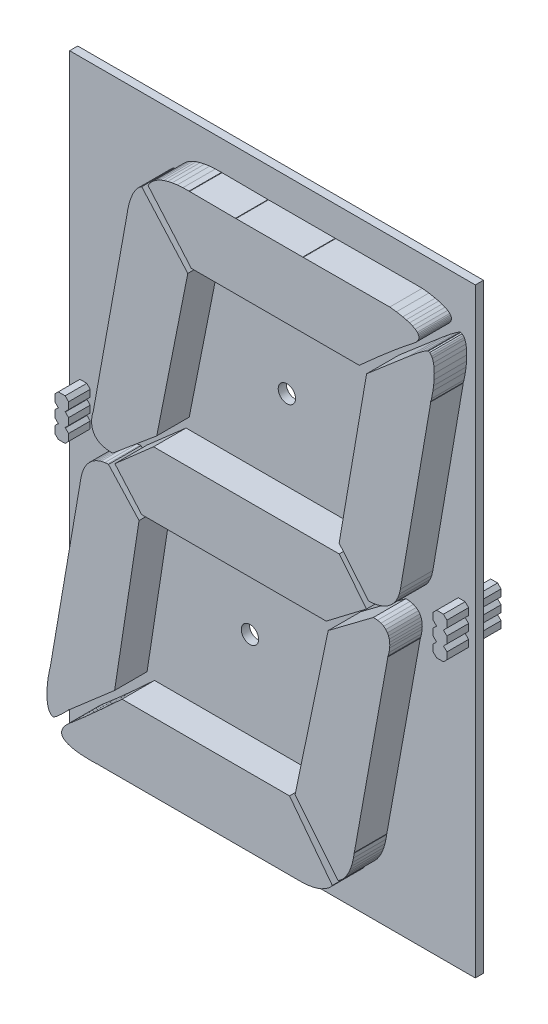
from build123d import *

# Parameters (mm, degrees)
CROQUIS2_W                 = 74.93
CROQUIS2_H                 = 110.871
SALIENTE_EXTRUIR2_DEPTH    = 1.5
SALIENTE_EXTRUIR3_DEPTH    = 6
CORTAR_EXTRUIR1_DEPTH      = 6
CORTAR_EXTRUIR1_DEPTH_BACK = 6
CROQUIS2_5_R               = 1.6
SALIENTE_EXTRUIR4_START    = -6
SALIENTE_EXTRUIR4_DEPTH    = 10


# Read off the part's stored shape, not the designer's step: Saliente-Extruir4
with BuildPart() as part:
    # Croquis2 → Saliente-Extruir2 (new body)
    with BuildSketch(Plane.XY):
        with Locations((37.465, 55.4355)):
            Rectangle(CROQUIS2_W, CROQUIS2_H)
    extrude(amount=-SALIENTE_EXTRUIR2_DEPTH)

    # Croquis2<4> → Saliente-Extruir3 (add)
    with BuildSketch(Plane.XY):
        with BuildLine():
            Line((59.4512, 93.2942), (59.502, 93.2942))
            Line((59.502, 93.2942), (59.539898139, 93.328028554))
            Line((59.539898139, 93.328028554), (62.941023468, 96.363933685))
            ThreePointArc((62.941023468, 96.363933685), (62.945494124, 96.43599486), (63.017509764, 96.430842441))
            Line((63.017509764, 96.430842441), (66.171178839, 99.133262262))
            ThreePointArc((66.171178839, 99.133262262), (66.177093675, 99.205294689), (66.24906445, 99.198671749))
            Line((66.24906445, 99.198671749), (67.832082216, 100.500937582))
            ThreePointArc((67.832082216, 100.500937582), (67.839536944, 100.572832713), (67.9113425, 100.564559567))
            Line((67.9113425, 100.564559567), (69.401112755, 101.731283706))
            Line((69.401112755, 101.731283706), (69.4411, 101.7626))
            Line((69.4411, 101.7626), (69.479097301, 101.796303043))
            Line((69.479097301, 101.796303043), (70.010158781, 102.267346702))
            Line((70.010158781, 102.267346702), (70.0481, 102.301))
            Line((70.0481, 102.301), (70.080499427, 102.340200473))
            Line((70.080499427, 102.340200473), (70.221517438, 102.510819932))
            Line((70.221517438, 102.510819932), (70.2539, 102.55))
            Line((70.2539, 102.55), (70.280410488, 102.593274203))
            Line((70.280410488, 102.593274203), (70.372095705, 102.742935905))
            Line((70.372095705, 102.742935905), (70.3986, 102.7862))
            Line((70.3986, 102.7862), (70.416910347, 102.833565306))
            Line((70.416910347, 102.833565306), (70.466663357, 102.962266669))
            Line((70.466663357, 102.962266669), (70.485, 103.0097))
            Line((70.485, 103.0097), (70.493452398, 103.059749595))
            Line((70.493452398, 103.059749595), (70.512148134, 103.170453557))
            Line((70.512148134, 103.170453557), (70.5206, 103.2205))
            Line((70.5206, 103.2205), (70.516734777, 103.271202631))
            Line((70.516734777, 103.271202631), (70.509160499, 103.370559339))
            Line((70.509160499, 103.370559339), (70.5053, 103.4212))
            Line((70.5053, 103.4212), (70.48964122, 103.469513379))
            Line((70.48964122, 103.469513379), (70.460039131, 103.560847245))
            Line((70.460039131, 103.560847245), (70.4444, 103.6091))
            Line((70.4444, 103.6091), (70.418898932, 103.653099382))
            Line((70.418898932, 103.653099382), (70.368244829, 103.740497652))
            Line((70.368244829, 103.740497652), (70.3428, 103.7844))
            Line((70.3428, 103.7844), (70.309985871, 103.823180334))
            Line((70.309985871, 103.823180334), (70.23588538, 103.910753641))
            Line((70.23588538, 103.910753641), (70.2031, 103.9495))
            Line((70.2031, 103.9495), (70.163251763, 103.981052224))
            Line((70.163251763, 103.981052224), (69.864408307, 104.217679393))
            Line((69.864408307, 104.217679393), (69.8246, 104.2492))
            Line((69.8246, 104.2492), (69.779811808, 104.27312212))
            Line((69.779811808, 104.27312212), (69.3843316, 104.484354695))
            Line((69.3843316, 104.484354695), (69.3395, 104.5083))
            Line((69.3395, 104.5083), (69.292206833, 104.526917367))
            Line((69.292206833, 104.526917367), (68.825372566, 104.710690742))
            Line((68.825372566, 104.710690742), (68.7781, 104.7293))
            Line((68.7781, 104.7293), (68.729494681, 104.744082523))
            Line((68.729494681, 104.744082523), (68.217194025, 104.899890498))
            Line((68.217194025, 104.899890498), (68.1685, 104.9147))
            Line((68.1685, 104.9147), (68.11914709, 104.926738066))
            Line((68.11914709, 104.926738066), (67.593016623, 105.055070785))
            Line((67.593016623, 105.055070785), (67.5437, 105.0671))
            Line((67.5437, 105.0671), (67.493708188, 105.076344104))
            Line((67.493708188, 105.076344104), (66.412549645, 105.276263693))
            Line((66.412549645, 105.276263693), (66.3626, 105.2855))
            Line((66.3626, 105.2855), (66.312148415, 105.291536662))
            Line((66.312148415, 105.291536662), (65.181091139, 105.426870571))
            Line((65.181091139, 105.426870571), (65.1307, 105.4329))
            Line((65.1307, 105.4329), (65.079849986, 105.432754668))
            Line((65.079849986, 105.432754668), (49.15669989, 105.387245475))
            ThreePointArc((49.15669989, 105.387245475), (49.105988252, 105.336299978), (49.055099911, 105.387068971))
            Line((49.055099911, 105.387068971), (36.738750212, 105.379531182))
            ThreePointArc((36.738750212, 105.379531182), (36.68781574, 105.328699956), (36.637150663, 105.3797997))
            Line((36.637150663, 105.3797997), (28.152949348, 105.430002075))
            ThreePointArc((28.152949348, 105.430002075), (28.102277149, 105.379499938), (28.05135278, 105.429747786))
            Line((28.05135278, 105.429747786), (26.974789912, 105.418147287))
            Line((26.974789912, 105.418147287), (26.924, 105.4176))
            Line((26.924, 105.4176), (26.873353042, 105.413809666))
            Line((26.873353042, 105.413809666), (25.923113675, 105.342695327))
            Line((25.923113675, 105.342695327), (25.8724, 105.3389))
            Line((25.8724, 105.3389), (25.822146048, 105.33177786))
            Line((25.822146048, 105.33177786), (24.990521494, 105.21391754))
            Line((24.990521494, 105.21391754), (24.9403, 105.2068))
            Line((24.9403, 105.2068), (24.890655674, 105.195924092))
            Line((24.890655674, 105.195924092), (24.1668694, 105.037359493))
            Line((24.1668694, 105.037359493), (24.1173, 105.0265))
            Line((24.1173, 105.0265), (24.068738769, 105.011686892))
            Line((24.068738769, 105.011686892), (23.449659141, 104.822842974))
            Line((23.449659141, 104.822842974), (23.401, 104.808))
            Line((23.401, 104.808), (23.35384082, 104.789173004))
            Line((23.35384082, 104.789173004), (22.830983371, 104.580436654))
            Line((22.830983371, 104.580436654), (22.7838, 104.5616))
            Line((22.7838, 104.5616), (22.738490874, 104.538617984))
            Line((22.738490874, 104.538617984), (22.303356026, 104.317905805))
            Line((22.303356026, 104.317905805), (22.258, 104.2949))
            Line((22.258, 104.2949), (22.215015566, 104.26797515))
            Line((22.215015566, 104.26797515), (21.859152808, 104.045067679))
            Line((21.859152808, 104.045067679), (21.8161, 104.0181))
            Line((21.8161, 104.0181), (21.775696178, 103.987305014))
            Line((21.775696178, 103.987305014), (21.493267577, 103.772043578))
            Line((21.493267577, 103.772043578), (21.4528, 103.7412))
            Line((21.4528, 103.7412), (21.415487918, 103.706813104))
            Line((21.415487918, 103.706813104), (21.198086197, 103.506455201))
            Line((21.198086197, 103.506455201), (21.1607, 103.472))
            Line((21.1607, 103.472), (21.128237272, 103.432960597))
            Line((21.128237272, 103.432960597), (20.791894482, 103.028477591))
            Line((20.791894482, 103.028477591), (20.7594, 102.9894))
            Line((20.7594, 102.9894), (20.733626132, 102.945664084))
            Line((20.733626132, 102.945664084), (20.584590838, 102.692764712))
            Line((20.584590838, 102.692764712), (20.5588, 102.649))
            Line((20.5588, 102.649), (20.539451758, 102.602078702))
            Line((20.539451758, 102.602078702), (20.524773067, 102.566481502))
            Line((20.524773067, 102.566481502), (20.5054, 102.5195))
            Line((20.5054, 102.5195), (20.538608745, 102.481014417))
            Line((20.538608745, 102.481014417), (28.432612601, 93.332660845))
            Line((28.432612601, 93.332660845), (28.4658, 93.2942))
            Line((28.4658, 93.2942), (28.5166, 93.2942))
            Line((28.5166, 93.2942), (59.4512, 93.2942))
        make_face()
        Polygon((14.391685098, 55.022016938), (14.3535, 54.9885), (14.386950963, 54.950169447), (19.265497916, 49.359974544), (19.2989, 49.3217), (19.3497, 49.3217), (53.345078724, 49.3217), (53.3959, 49.3217), (53.436277547, 49.352413775), (60.8457, 54.9885), (55.812809992, 61.22277289), (55.7809, 61.2623), (55.7301, 61.2623), (21.551870759, 61.2623), (21.5011, 61.2623), (21.462918345, 61.228786084), align=None)
        with BuildLine():
            Line((15.7302, 17.9756), (15.6794, 17.9756))
            Line((15.6794, 17.9756), (15.642014267, 17.941206004))
            Line((15.642014267, 17.941206004), (11.973109053, 14.565899445))
            ThreePointArc((11.973109053, 14.565899445), (11.969875017, 14.493977228), (11.897963922, 14.497449787))
            Line((11.897963922, 14.497449787), (8.920105145, 11.812002677))
            ThreePointArc((8.920105145, 11.812002677), (8.915958328, 11.739898837), (8.843908054, 11.744890634))
            Line((8.843908054, 11.744890634), (6.52320707, 9.748708391))
            ThreePointArc((6.52320707, 9.748708391), (6.517716159, 9.677013821), (6.446034932, 9.682676262))
            Line((6.446034932, 9.682676262), (5.977174803, 9.283617137))
            Line((5.977174803, 9.283617137), (5.9385, 9.2507))
            Line((5.9385, 9.2507), (5.901724969, 9.215576226))
            Line((5.901724969, 9.215576226), (5.523123571, 8.853974625))
            Line((5.523123571, 8.853974625), (5.4864, 8.8189))
            Line((5.4864, 8.8189), (5.452588831, 8.781009964))
            Line((5.452588831, 8.781009964), (5.162056921, 8.455429244))
            Line((5.162056921, 8.455429244), (5.1283, 8.4176))
            Line((5.1283, 8.4176), (5.098110618, 8.376692165))
            Line((5.098110618, 8.376692165), (4.886637227, 8.090137162))
            Line((4.886637227, 8.090137162), (4.8565, 8.0493))
            Line((4.8565, 8.0493), (4.831672954, 8.004937132))
            Line((4.831672954, 8.004937132), (4.690795104, 7.753205793))
            Line((4.690795104, 7.753205793), (4.666, 7.7089))
            Line((4.666, 7.7089), (4.648416302, 7.661225563))
            Line((4.648416302, 7.661225563), (4.569283329, 7.446673436))
            Line((4.569283329, 7.446673436), (4.5517, 7.399))
            Line((4.5517, 7.399), (4.544504099, 7.348699413))
            Line((4.544504099, 7.348699413), (4.518194061, 7.164787727))
            Line((4.518194061, 7.164787727), (4.511, 7.1145))
            Line((4.511, 7.1145), (4.515517367, 7.063901547))
            Line((4.515517367, 7.063901547), (4.529388504, 6.908532694))
            Line((4.529388504, 6.908532694), (4.5339, 6.858))
            Line((4.5339, 6.858), (4.551057108, 6.810152551))
            Line((4.551057108, 6.810152551), (4.600542892, 6.672147449))
            Line((4.600542892, 6.672147449), (4.6177, 6.6243))
            Line((4.6177, 6.6243), (4.645611276, 6.581924499))
            Line((4.645611276, 6.581924499), (4.726930063, 6.458464562))
            Line((4.726930063, 6.458464562), (4.7549, 6.416))
            Line((4.7549, 6.416), (4.791046691, 6.38034665))
            Line((4.791046691, 6.38034665), (4.909232314, 6.263774059))
            Line((4.909232314, 6.263774059), (4.9454, 6.2281))
            Line((4.9454, 6.2281), (4.986891452, 6.198787896))
            Line((4.986891452, 6.198787896), (5.137603741, 6.0923155))
            Line((5.137603741, 6.0923155), (5.1791, 6.063))
            Line((5.1791, 6.063), (5.225020097, 6.041342705))
            Line((5.225020097, 6.041342705), (5.71479468, 5.810350325))
            Line((5.71479468, 5.810350325), (5.7607, 5.7887))
            Line((5.7607, 5.7887), (5.809468268, 5.774512867))
            Line((5.809468268, 5.774512867), (6.410444939, 5.59968329))
            Line((6.410444939, 5.59968329), (6.4592, 5.5855))
            Line((6.4592, 5.5855), (6.509163306, 5.57632254))
            Line((6.509163306, 5.57632254), (7.183933111, 5.452378118))
            Line((7.183933111, 5.452378118), (7.2339, 5.4432))
            Line((7.2339, 5.4432), (7.284345417, 5.437310942))
            Line((7.284345417, 5.437310942), (7.988634854, 5.355091361))
            Line((7.988634854, 5.355091361), (8.0391, 5.3492))
            Line((8.0391, 5.3492), (8.089846012, 5.34686364))
            Line((8.089846012, 5.34686364), (9.532700675, 5.280434211))
            Line((9.532700675, 5.280434211), (9.5834, 5.2781))
            Line((9.5834, 5.2781), (9.634249984, 5.27865149))
            Line((9.634249984, 5.27865149), (10.703553708, 5.29024855))
            Line((10.703553708, 5.29024855), (10.7544, 5.2908))
            Line((10.7544, 5.2908), (10.80510372, 5.29301447))
            Line((10.80510372, 5.29301447), (11.168448381, 5.308883438))
            ThreePointArc((11.168448381, 5.308883438), (11.218091455, 5.361887903), (11.27, 5.3111))
            Line((11.27, 5.3111), (48.435273209, 5.3111))
            Line((48.435273209, 5.3111), (48.4861, 5.3111))
            Line((48.4861, 5.3111), (48.53680053, 5.312783604))
            Line((48.53680053, 5.312783604), (49.278564726, 5.337415242))
            Line((49.278564726, 5.337415242), (49.3293, 5.3391))
            Line((49.3293, 5.3391), (49.379945918, 5.343794205))
            Line((49.379945918, 5.343794205), (50.045891555, 5.405518537))
            Line((50.045891555, 5.405518537), (50.0964, 5.4102))
            Line((50.0964, 5.4102), (50.146547317, 5.41846628))
            Line((50.146547317, 5.41846628), (50.739695851, 5.516240836))
            Line((50.739695851, 5.516240836), (50.7898, 5.5245))
            Line((50.7898, 5.5245), (50.839354522, 5.536030604))
            Line((50.839354522, 5.536030604), (51.36268731, 5.657802398))
            Line((51.36268731, 5.657802398), (51.4121, 5.6693))
            Line((51.4121, 5.6693), (51.460643753, 5.684370117))
            Line((51.460643753, 5.684370117), (51.919913347, 5.826947609))
            Line((51.919913347, 5.826947609), (51.9684, 5.842))
            Line((51.9684, 5.842), (52.015588208, 5.860729735))
            Line((52.015588208, 5.860729735), (52.413891311, 6.018822444))
            Line((52.413891311, 6.018822444), (52.4612, 6.0376))
            Line((52.4612, 6.0376), (52.506200819, 6.061098434))
            Line((52.506200819, 6.061098434), (53.21875904, 6.433180605))
            Line((53.21875904, 6.433180605), (53.2638, 6.4567))
            Line((53.2638, 6.4567), (53.305086619, 6.486318661))
            Line((53.305086619, 6.486318661), (53.806683936, 6.846160215))
            Line((53.806683936, 6.846160215), (53.848, 6.8758))
            Line((53.848, 6.8758), (53.884747126, 6.910853009))
            Line((53.884747126, 6.910853009), (54.197360673, 7.209054431))
            Line((54.197360673, 7.209054431), (54.2341, 7.2441))
            Line((54.2341, 7.2441), (54.265505983, 7.283995291))
            Line((54.265505983, 7.283995291), (54.484576784, 7.562282817))
            Line((54.484576784, 7.562282817), (54.516, 7.6022))
            Line((54.516, 7.6022), (54.485222264, 7.642616964))
            Line((54.485222264, 7.642616964), (46.647376782, 17.935184289))
            Line((46.647376782, 17.935184289), (46.6166, 17.9756))
            Line((46.6166, 17.9756), (46.5658, 17.9756))
            Line((46.5658, 17.9756), (15.7302, 17.9756))
        make_face()
        with BuildLine():
            Line((72.292544417, 101.909138837), (72.2452, 101.9277))
            Line((72.2452, 101.9277), (72.194795614, 101.921837951))
            Line((72.194795614, 101.921837951), (72.186447995, 101.92086712))
            Line((72.186447995, 101.92086712), (72.136, 101.915))
            Line((72.136, 101.915), (72.089340365, 101.894877856))
            Line((72.089340365, 101.894877856), (72.017561623, 101.863923002))
            Line((72.017561623, 101.863923002), (71.9709, 101.8438))
            Line((71.9709, 101.8438), (71.927578968, 101.817326036))
            Line((71.927578968, 101.817326036), (71.55707594, 101.590907519))
            Line((71.55707594, 101.590907519), (71.5137, 101.5644))
            Line((71.5137, 101.5644), (71.472931064, 101.534128945))
            Line((71.472931064, 101.534128945), (70.360702815, 100.70829621))
            Line((70.360702815, 100.70829621), (70.3199, 100.678))
            Line((70.3199, 100.678), (70.280619956, 100.645753944))
            Line((70.280619956, 100.645753944), (68.756409642, 99.394488261))
            Line((68.756409642, 99.394488261), (68.7172, 99.3623))
            Line((68.7172, 99.3623), (68.678593072, 99.329174506))
            Line((68.678593072, 99.329174506), (60.88429034, 92.641511262))
            Line((60.88429034, 92.641511262), (60.8457, 92.6084))
            Line((60.8457, 92.6084), (60.837128661, 92.558279125))
            Line((60.837128661, 92.558279125), (55.789461797, 63.042065076))
            Line((55.789461797, 63.042065076), (55.7809, 62.992))
            Line((55.7809, 62.992), (55.81332664, 62.952875638))
            Line((55.81332664, 62.952875638), (61.171396178, 56.488096832))
            Line((61.171396178, 56.488096832), (61.2038, 56.449))
            Line((61.2038, 56.449), (61.2547, 56.449))
            Line((61.2547, 56.449), (61.3715, 56.449))
            Line((61.3715, 56.449), (61.4223, 56.449))
            Line((61.4223, 56.449), (61.472976674, 56.452537608))
            Line((61.472976674, 56.452537608), (61.953249009, 56.486064185))
            Line((61.953249009, 56.486064185), (62.0039, 56.4896))
            Line((62.0039, 56.4896), (62.053978839, 56.498555879))
            Line((62.053978839, 56.498555879), (62.792089943, 56.630556422))
            Line((62.792089943, 56.630556422), (62.8421, 56.6395))
            Line((62.8421, 56.6395), (62.891108177, 56.653168671))
            Line((62.891108177, 56.653168671), (63.275784121, 56.760457071))
            Line((63.275784121, 56.760457071), (63.3247, 56.7741))
            Line((63.3247, 56.7741), (63.372360838, 56.791816066))
            Line((63.372360838, 56.791816066), (63.78257028, 56.944295501))
            Line((63.78257028, 56.944295501), (63.8302, 56.962))
            Line((63.8302, 56.962), (63.876168828, 56.983745146))
            Line((63.876168828, 56.983745146), (64.299904864, 57.184189714))
            Line((64.299904864, 57.184189714), (64.3458, 57.2059))
            Line((64.3458, 57.2059), (64.389108175, 57.232397207))
            Line((64.389108175, 57.232397207), (64.813037875, 57.491769785))
            Line((64.813037875, 57.491769785), (64.8564, 57.5183))
            Line((64.8564, 57.5183), (64.896249371, 57.549729806))
            Line((64.896249371, 57.549729806), (65.309240428, 57.875462148))
            Line((65.309240428, 57.875462148), (65.3491, 57.9069))
            Line((65.3491, 57.9069), (65.38475257, 57.9431432))
            Line((65.38475257, 57.9431432), (65.778244921, 58.34315425))
            Line((65.778244921, 58.34315425), (65.8139, 58.3794))
            Line((65.8139, 58.3794), (65.844225502, 58.420195795))
            Line((65.844225502, 58.420195795), (66.202723305, 58.902469863))
            Line((66.202723305, 58.902469863), (66.233, 58.9432))
            Line((66.233, 58.9432), (66.257279162, 58.987827348))
            Line((66.257279162, 58.987827348), (66.569427555, 59.561584998))
            Line((66.569427555, 59.561584998), (66.5937, 59.6062))
            Line((66.5937, 59.6062), (66.61158779, 59.65373606))
            Line((66.61158779, 59.65373606), (66.865399906, 60.328231243))
            Line((66.865399906, 60.328231243), (66.8833, 60.3758))
            Line((66.8833, 60.3758), (66.894781535, 60.425281675))
            Line((66.894781535, 60.425281675), (67.07750503, 61.212760424))
            Line((67.07750503, 61.212760424), (67.089, 61.2623))
            Line((67.089, 61.2623), (67.097573527, 61.31232841))
            Line((67.097573527, 61.31232841), (72.7091207, 94.056937903))
            ThreePointArc((72.7091207, 94.056937903), (72.667907393, 94.117229151), (72.729567136, 94.156365417))
            Line((72.729567136, 94.156365417), (72.832823208, 94.585894415))
            Line((72.832823208, 94.585894415), (72.8447, 94.6353))
            Line((72.8447, 94.6353), (72.854287899, 94.685200323))
            Line((72.854287899, 94.685200323), (73.096704243, 95.946858779))
            Line((73.096704243, 95.946858779), (73.1063, 95.9968))
            Line((73.1063, 95.9968), (73.113314551, 96.047069068))
            Line((73.113314551, 96.047069068), (73.223675607, 96.837960399))
            Line((73.223675607, 96.837960399), (73.2307, 96.8883))
            Line((73.2307, 96.8883), (73.235174296, 96.938941368))
            Line((73.235174296, 96.938941368), (73.312629131, 97.815597418))
            Line((73.312629131, 97.815597418), (73.3171, 97.8662))
            Line((73.3171, 97.8662), (73.318740893, 97.916973196))
            Line((73.318740893, 97.916973196), (73.348456618, 98.836449785))
            Line((73.348456618, 98.836449785), (73.3501, 98.8873))
            Line((73.3501, 98.8873), (73.347583105, 98.938014434))
            Line((73.347583105, 98.938014434), (73.301818736, 99.86014847))
            Line((73.301818736, 99.86014847), (73.2993, 99.9109))
            Line((73.2993, 99.9109), (73.291696285, 99.961131794))
            Line((73.291696285, 99.961131794), (73.210398927, 100.498199837))
            Line((73.210398927, 100.498199837), (73.2028, 100.5484))
            Line((73.2028, 100.5484), (73.187704965, 100.596876179))
            Line((73.187704965, 100.596876179), (73.024902236, 101.119700696))
            Line((73.024902236, 101.119700696), (73.0098, 101.1682))
            Line((73.0098, 101.1682), (72.986579324, 101.213378094))
            Line((72.986579324, 101.213378094), (72.893294476, 101.394872881))
            Line((72.893294476, 101.394872881), (72.8701, 101.44))
            Line((72.8701, 101.44), (72.839032376, 101.480182951))
            Line((72.839032376, 101.480182951), (72.728387988, 101.62329071))
            Line((72.728387988, 101.62329071), (72.6973, 101.6635))
            Line((72.6973, 101.6635), (72.657897458, 101.695604356))
            Line((72.657897458, 101.695604356), (72.530944341, 101.799043065))
            Line((72.530944341, 101.799043065), (72.4916, 101.8311))
            Line((72.4916, 101.8311), (72.444304366, 101.849642038))
            Line((72.444304366, 101.849642038), (72.292544417, 101.909138837))
        make_face()
        with BuildLine():
            Line((16.7201923, 96.726401267), (16.589384826, 95.927969499))
            ThreePointArc((16.589384826, 95.927969499), (16.63129794, 95.869188009), (16.572161469, 95.827777256))
            Line((16.572161469, 95.827777256), (10.377314731, 61.436745771))
            ThreePointArc((10.377314731, 61.436745771), (10.417523735, 61.374185511), (10.35225, 61.33855))
            Line((10.35225, 61.33855), (10.313236413, 61.221509239))
            Line((10.313236413, 61.221509239), (10.2972, 61.1734))
            Line((10.2972, 61.1734), (10.284870588, 61.124082353))
            Line((10.284870588, 61.124082353), (10.169796751, 60.663787006))
            Line((10.169796751, 60.663787006), (10.1575, 60.6146))
            Line((10.1575, 60.6146), (10.151017883, 60.564197712))
            Line((10.151017883, 60.564197712), (10.06238001, 59.874985905))
            Line((10.06238001, 59.874985905), (10.0559, 59.8246))
            Line((10.0559, 59.8246), (10.055604519, 59.773799974))
            Line((10.055604519, 59.773799974), (10.053595344, 59.428376498))
            Line((10.053595344, 59.428376498), (10.0533, 59.3776))
            Line((10.0533, 59.3776), (10.058604754, 59.327100499))
            Line((10.058604754, 59.327100499), (10.096285092, 58.96839616))
            Line((10.096285092, 58.96839616), (10.1016, 58.9178))
            Line((10.1016, 58.9178), (10.113527729, 58.868444618))
            Line((10.113527729, 58.868444618), (10.201392465, 58.504871824))
            Line((10.201392465, 58.504871824), (10.2133, 58.4556))
            Line((10.2133, 58.4556), (10.233094846, 58.408797823))
            Line((10.233094846, 58.408797823), (10.381507261, 58.057897195))
            Line((10.381507261, 58.057897195), (10.4013, 58.0111))
            Line((10.4013, 58.0111), (10.42960149, 57.968900999))
            Line((10.42960149, 57.968900999), (10.652417097, 57.636671286))
            Line((10.652417097, 57.636671286), (10.6807, 57.5945))
            Line((10.6807, 57.5945), (10.717200298, 57.559200308))
            Line((10.717200298, 57.559200308), (11.030269258, 57.256429135))
            Line((11.030269258, 57.256429135), (11.0668, 57.2211))
            Line((11.0668, 57.2211), (11.109720204, 57.194002834))
            Line((11.109720204, 57.194002834), (11.526766474, 56.930705577))
            Line((11.526766474, 56.930705577), (11.5697, 56.9036))
            Line((11.5697, 56.9036), (11.617100464, 56.885401208))
            Line((11.617100464, 56.885401208), (12.157299077, 56.677998969))
            Line((12.157299077, 56.677998969), (12.2047, 56.6598))
            Line((12.2047, 56.6598), (12.254493909, 56.649869408))
            Line((12.254493909, 56.649869408), (12.932137355, 56.514724357))
            Line((12.932137355, 56.514724357), (12.9819, 56.5048))
            Line((12.9819, 56.5048), (13.03265219, 56.501786622))
            Line((13.03265219, 56.501786622), (13.871017701, 56.452009228))
            Line((13.871017701, 56.452009228), (13.9217, 56.449))
            Line((13.9217, 56.449), (13.960648003, 56.48166193))
            Line((13.960648003, 56.48166193), (22.051494972, 63.266674109))
            Line((22.051494972, 63.266674109), (22.0904, 63.2993))
            Line((22.0904, 63.2993), (22.100296105, 63.349100774))
            Line((22.100296105, 63.349100774), (27.815797653, 92.111567814))
            Line((27.815797653, 92.111567814), (27.8257, 92.1614))
            Line((27.8257, 92.1614), (27.792059562, 92.199358465))
            Line((27.792059562, 92.199358465), (19.3504083, 101.724564963))
            Line((19.3504083, 101.724564963), (19.3167, 101.7626))
            Line((19.3167, 101.7626), (19.273724808, 101.735489968))
            Line((19.273724808, 101.735489968), (19.029490071, 101.581419418))
            Line((19.029490071, 101.581419418), (18.9865, 101.5543))
            Line((18.9865, 101.5543), (18.949026027, 101.520076266))
            Line((18.949026027, 101.520076266), (18.673507152, 101.268454035))
            Line((18.673507152, 101.268454035), (18.636, 101.2342))
            Line((18.636, 101.2342), (18.603773913, 101.195030339))
            Line((18.603773913, 101.195030339), (18.244041533, 100.757788436))
            Line((18.244041533, 100.757788436), (18.2118, 100.7186))
            Line((18.2118, 100.7186), (18.185498294, 100.675201034))
            Line((18.185498294, 100.675201034), (17.780944567, 100.007669688))
            Line((17.780944567, 100.007669688), (17.7546, 99.9642))
            Line((17.7546, 99.9642), (17.734285332, 99.917606393))
            Line((17.734285332, 99.917606393), (17.32530995, 98.979582786))
            Line((17.32530995, 98.979582786), (17.305, 98.933))
            Line((17.305, 98.933), (17.288932284, 98.884789228))
            Line((17.288932284, 98.884789228), (17.110284645, 98.348761567))
            Line((17.110284645, 98.348761567), (17.0942, 98.3005))
            Line((17.0942, 98.3005), (17.080995887, 98.251501111))
            Line((17.080995887, 98.251501111), (16.914396634, 97.633271135))
            Line((16.914396634, 97.633271135), (16.9012, 97.5843))
            Line((16.9012, 97.5843), (16.890565463, 97.534586003))
            Line((16.890565463, 97.534586003), (16.739043884, 96.826257692))
            Line((16.739043884, 96.826257692), (16.7284, 96.7765))
            Line((16.7284, 96.7765), (16.7201923, 96.726401267))
        make_face()
        with BuildLine():
            Line((2.86357701, 8.807091627), (2.9108, 8.7884))
            Line((2.9108, 8.7884), (2.961150755, 8.795744832))
            Line((2.961150755, 8.795744832), (2.964705374, 8.796263356))
            Line((2.964705374, 8.796263356), (3.015, 8.8036))
            Line((3.015, 8.8036), (3.060702358, 8.825691024))
            Line((3.060702358, 8.825691024), (3.116535932, 8.852679147))
            Line((3.116535932, 8.852679147), (3.1623, 8.8748))
            Line((3.1623, 8.8748), (3.203752138, 8.904130142))
            Line((3.203752138, 8.904130142), (3.512030217, 9.122257372))
            Line((3.512030217, 9.122257372), (3.5535, 9.1516))
            Line((3.5535, 9.1516), (3.591428286, 9.185372022))
            Line((3.591428286, 9.185372022), (4.511173626, 10.00432968))
            Line((4.511173626, 10.00432968), (4.5491, 10.0381))
            Line((4.5491, 10.0381), (4.584943023, 10.074079495))
            Line((4.584943023, 10.074079495), (5.826468257, 11.320331828))
            ThreePointArc((5.826468257, 11.320331828), (5.827626913, 11.393484883), (5.900687564, 11.389630887))
            Line((5.900687564, 11.389630887), (14.269473907, 18.656022487))
            Line((14.269473907, 18.656022487), (14.3078, 18.6893))
            Line((14.3078, 18.6893), (14.315510249, 18.739551241))
            Line((14.315510249, 18.739551241), (18.816191326, 48.072559026))
            Line((18.816191326, 48.072559026), (18.8239, 48.1228))
            Line((18.8239, 48.1228), (18.789571731, 48.160249795))
            Line((18.789571731, 48.160249795), (13.214392628, 54.242389087))
            Line((13.214392628, 54.242389087), (13.1801, 54.2798))
            Line((13.1801, 54.2798), (13.129266218, 54.2798))
            Line((13.129266218, 54.2798), (13.048, 54.2798))
            Line((13.048, 54.2798), (12.9972, 54.2798))
            Line((12.9972, 54.2798), (12.94659213, 54.275385988))
            Line((12.94659213, 54.275385988), (12.552498848, 54.241013225))
            Line((12.552498848, 54.241013225), (12.5019, 54.2366))
            Line((12.5019, 54.2366), (12.452184585, 54.226203003))
            Line((12.452184585, 54.226203003), (11.835339111, 54.097201953))
            Line((11.835339111, 54.097201953), (11.7856, 54.0868))
            Line((11.7856, 54.0868), (11.73736897, 54.070719083))
            Line((11.73736897, 54.070719083), (11.422338827, 53.965683516))
            Line((11.422338827, 53.965683516), (11.3741, 53.9496))
            Line((11.3741, 53.9496), (11.327563345, 53.929338557))
            Line((11.327563345, 53.929338557), (10.988880275, 53.781880435))
            Line((10.988880275, 53.781880435), (10.9423, 53.7616))
            Line((10.9423, 53.7616), (10.897900888, 53.736998197))
            Line((10.897900888, 53.736998197), (10.542216074, 53.539911201))
            Line((10.542216074, 53.539911201), (10.4978, 53.5153))
            Line((10.4978, 53.5153), (10.456407692, 53.485794282))
            Line((10.456407692, 53.485794282), (10.097237932, 53.229766958))
            Line((10.097237932, 53.229766958), (10.0559, 53.2003))
            Line((10.0559, 53.2003), (10.01830548, 53.166070313))
            Line((10.01830548, 53.166070313), (9.6666305, 52.845871397))
            Line((9.6666305, 52.845871397), (9.6291, 52.8117))
            Line((9.6291, 52.8117), (9.595955753, 52.77316492))
            Line((9.595955753, 52.77316492), (9.255900049, 52.377799958))
            Line((9.255900049, 52.377799958), (9.2227, 52.3392))
            Line((9.2227, 52.3392), (9.194931875, 52.296692075))
            Line((9.194931875, 52.296692075), (8.882174012, 51.817916937))
            Line((8.882174012, 51.817916937), (8.8544, 51.7754))
            Line((8.8544, 51.7754), (8.832024738, 51.729768506))
            Line((8.832024738, 51.729768506), (8.551667613, 51.158015895))
            Line((8.551667613, 51.158015895), (8.5293, 51.1124))
            Line((8.5293, 51.1124), (8.512857337, 51.064329647))
            Line((8.512857337, 51.064329647), (8.281616648, 50.388294297))
            Line((8.281616648, 50.388294297), (8.2652, 50.3403))
            Line((8.2652, 50.3403), (8.254105621, 50.290677561))
            Line((8.254105621, 50.290677561), (8.078081599, 49.503365273))
            Line((8.078081599, 49.503365273), (8.067, 49.4538))
            Line((8.067, 49.4538), (8.058428316, 49.403759226))
            Line((8.058428316, 49.403759226), (2.449465702, 16.659105847))
            ThreePointArc((2.449465702, 16.659105847), (2.490684624, 16.598823944), (2.429025602, 16.559695023))
            Line((2.429025602, 16.559695023), (2.325774663, 16.130106077))
            Line((2.325774663, 16.130106077), (2.3139, 16.0807))
            Line((2.3139, 16.0807), (2.304333851, 16.030916531))
            Line((2.304333851, 16.030916531), (2.061888949, 14.769202125))
            Line((2.061888949, 14.769202125), (2.0523, 14.7193))
            Line((2.0523, 14.7193), (2.045277303, 14.668972555))
            Line((2.045277303, 14.668972555), (1.934912619, 13.878055225))
            Line((1.934912619, 13.878055225), (1.9279, 13.8278))
            Line((1.9279, 13.8278), (1.923285331, 13.777168409))
            Line((1.923285331, 13.777168409), (1.843611693, 12.902998936))
            Line((1.843611693, 12.902998936), (1.839, 12.8524))
            Line((1.839, 12.8524), (1.837483035, 12.80161399))
            Line((1.837483035, 12.80161399), (1.810017368, 11.882099484))
            Line((1.810017368, 11.882099484), (1.8085, 11.8313))
            Line((1.8085, 11.8313), (1.810884689, 11.780533837))
            Line((1.810884689, 11.780533837), (1.854318599, 10.855896165))
            Line((1.854318599, 10.855896165), (1.8567, 10.8052))
            Line((1.8567, 10.8052), (1.864511433, 10.754941981))
            Line((1.864511433, 10.754941981), (1.947997642, 10.217799634))
            Line((1.947997642, 10.217799634), (1.9558, 10.1676))
            Line((1.9558, 10.1676), (1.970906272, 10.119095562))
            Line((1.970906272, 10.119095562), (2.133705312, 9.596367243))
            Line((2.133705312, 9.596367243), (2.1488, 9.5479))
            Line((2.1488, 9.5479), (2.172217988, 9.502757092))
            Line((2.172217988, 9.502757092), (2.26513441, 9.323641899))
            Line((2.26513441, 9.323641899), (2.2885, 9.2786))
            Line((2.2885, 9.2786), (2.319057277, 9.238024533))
            Line((2.319057277, 9.238024533), (2.428157598, 9.093155716))
            Line((2.428157598, 9.093155716), (2.4587, 9.0526))
            Line((2.4587, 9.0526), (2.49830197, 9.020716897))
            Line((2.49830197, 9.020716897), (2.627445735, 8.916744696))
            Line((2.627445735, 8.916744696), (2.667, 8.8849))
            Line((2.667, 8.8849), (2.71429545, 8.866179693))
            Line((2.71429545, 8.866179693), (2.86357701, 8.807091627))
        make_face()
        with BuildLine():
            Line((58.43345449, 13.989649251), (58.566495382, 14.788249847))
            ThreePointArc((58.566495382, 14.788249847), (58.524804044, 14.847023365), (58.583841761, 14.888339731))
            Line((58.583841761, 14.888339731), (64.778803284, 49.279355188))
            ThreePointArc((64.778803284, 49.279355188), (64.738473644, 49.341653077), (64.803353247, 49.377682843))
            Line((64.803353247, 49.377682843), (64.840844999, 49.494311701))
            Line((64.840844999, 49.494311701), (64.8564, 49.5427))
            Line((64.8564, 49.5427), (64.868504591, 49.592036583))
            Line((64.868504591, 49.592036583), (64.981400123, 50.05218263))
            Line((64.981400123, 50.05218263), (64.9935, 50.1015))
            Line((64.9935, 50.1015), (65.000936953, 50.15175192))
            Line((65.000936953, 50.15175192), (65.102959445, 50.841123741))
            Line((65.102959445, 50.841123741), (65.1104, 50.8914))
            Line((65.1104, 50.8914), (65.112987912, 50.942148044))
            Line((65.112987912, 50.942148044), (65.130610396, 51.287718772))
            Line((65.130610396, 51.287718772), (65.1332, 51.3385))
            Line((65.1332, 51.3385), (65.130961203, 51.389198265))
            Line((65.130961203, 51.389198265), (65.115140536, 51.747462341))
            Line((65.115140536, 51.747462341), (65.1129, 51.7982))
            Line((65.1129, 51.7982), (65.105179904, 51.848396913))
            Line((65.105179904, 51.848396913), (65.049518181, 52.210315543))
            Line((65.049518181, 52.210315543), (65.0418, 52.2605))
            Line((65.0418, 52.2605), (65.027084729, 52.309095378))
            Line((65.027084729, 52.309095378), (64.921923716, 52.656376732))
            Line((64.921923716, 52.656376732), (64.9072, 52.705))
            Line((64.9072, 52.705), (64.884588538, 52.750494305))
            Line((64.884588538, 52.750494305), (64.721491088, 53.078646687))
            Line((64.721491088, 53.078646687), (64.6989, 53.1241))
            Line((64.6989, 53.1241), (64.667257234, 53.16385575))
            Line((64.667257234, 53.16385575), (64.433347741, 53.457738))
            Line((64.433347741, 53.457738), (64.4017, 53.4975))
            Line((64.4017, 53.4975), (64.361971115, 53.529076542))
            Line((64.361971115, 53.529076542), (64.045203206, 53.780843868))
            Line((64.045203206, 53.780843868), (64.0055, 53.8124))
            Line((64.0055, 53.8124), (63.959699281, 53.834498507))
            Line((63.959699281, 53.834498507), (63.545760658, 54.034220822))
            Line((63.545760658, 54.034220822), (63.5, 54.0563))
            Line((63.5, 54.0563), (63.45076542, 54.068711086))
            Line((63.45076542, 54.068711086), (62.924412808, 54.201394403))
            Line((62.924412808, 54.201394403), (62.8752, 54.2138))
            Line((62.8752, 54.2138), (62.824500935, 54.217512609))
            Line((62.824500935, 54.217512609), (62.163880622, 54.265888742))
            Line((62.163880622, 54.265888742), (62.1132, 54.2696))
            Line((62.1132, 54.2696), (62.072581157, 54.239108518))
            Line((62.072581157, 54.239108518), (53.799708049, 48.028883379))
            Line((53.799708049, 48.028883379), (53.7591, 47.9984))
            Line((53.7591, 47.9984), (53.748726402, 47.948694483))
            Line((53.748726402, 47.948694483), (47.653169235, 18.74158461))
            Line((47.653169235, 18.74158461), (47.6428, 18.6919))
            Line((47.6428, 18.6919), (47.674774009, 18.652369432))
            Line((47.674774009, 18.652369432), (55.510242807, 8.965109778))
            Line((55.510242807, 8.965109778), (55.5422, 8.9256))
            Line((55.5422, 8.9256), (55.58849031, 8.946421527))
            Line((55.58849031, 8.946421527), (55.597472052, 8.950461543))
            Line((55.597472052, 8.950461543), (55.6438, 8.9713))
            Line((55.6438, 8.9713), (55.687216627, 8.997672646))
            Line((55.687216627, 8.997672646), (55.872142375, 9.110002451))
            Line((55.872142375, 9.110002451), (55.9156, 9.1364))
            Line((55.9156, 9.1364), (55.955045543, 9.16835551))
            Line((55.955045543, 9.16835551), (56.277409838, 9.429508343))
            Line((56.277409838, 9.429508343), (56.3169, 9.4615))
            Line((56.3169, 9.4615), (56.351200489, 9.498903695))
            Line((56.351200489, 9.498903695), (56.760076812, 9.944771552))
            Line((56.760076812, 9.944771552), (56.7944, 9.9822))
            Line((56.7944, 9.9822), (56.822828674, 10.024280643))
            Line((56.822828674, 10.024280643), (57.279027753, 10.699554859))
            Line((57.279027753, 10.699554859), (57.3075, 10.7417))
            Line((57.3075, 10.7417), (57.331124727, 10.786586981))
            Line((57.331124727, 10.786586981), (57.537820336, 11.179308638))
            Line((57.537820336, 11.179308638), (57.5615, 11.2243))
            Line((57.5615, 11.2243), (57.581952035, 11.270749105))
            Line((57.581952035, 11.270749105), (57.784828621, 11.731506962))
            Line((57.784828621, 11.731506962), (57.8053, 11.778))
            Line((57.8053, 11.778), (57.822507082, 11.825797451))
            Line((57.822507082, 11.825797451), (58.016673709, 12.365149191))
            Line((58.016673709, 12.365149191), (58.0339, 12.413))
            Line((58.0339, 12.413), (58.048028958, 12.461756096))
            Line((58.048028958, 12.461756096), (58.228074043, 13.083054258))
            Line((58.228074043, 13.083054258), (58.2422, 13.1318))
            Line((58.2422, 13.1318), (58.253408609, 13.181298051))
            Line((58.253408609, 13.181298051), (58.413893369, 13.890010683))
            Line((58.413893369, 13.890010683), (58.4251, 13.9395))
            Line((58.4251, 13.9395), (58.43345449, 13.989649251))
        make_face()
    extrude(amount=SALIENTE_EXTRUIR3_DEPTH)

    # Croquis2<5> → Cortar-Extruir1 (cut, two sides: drawn at the far end of the back side and taken through both)
    with BuildSketch(Plane.XY.offset(-CORTAR_EXTRUIR1_DEPTH_BACK)):
        with Locations((40.1269, 76.0705)):
            Circle(CROQUIS2_5_R)
        with Locations((33.3045, 34.1427)):
            Circle(CROQUIS2_5_R)
    extrude(amount=CORTAR_EXTRUIR1_DEPTH + CORTAR_EXTRUIR1_DEPTH_BACK, mode=Mode.SUBTRACT)

    # Saliente-Extruir4 outline → Saliente-Extruir4 (add)
    with BuildSketch(Plane.XY.offset(SALIENTE_EXTRUIR4_START)):
        with BuildLine():
            Line((1.2625, 56.0755), (1.2625, 54.8055))
            Line((1.2625, 54.8055), (1.8616, 54.2064))
            ThreePointArc((1.8616, 54.2064), (1.948355635, 54.1705), (1.8616, 54.1346))
            Line((1.8616, 54.1346), (1.2625, 53.5355))
            Line((1.2625, 53.5355), (1.2625, 52.2655))
            Line((1.2625, 52.2655), (1.8975, 51.6305))
            Line((1.8975, 51.6305), (3.1675, 51.6305))
            Line((3.1675, 51.6305), (3.8025, 52.2655))
            Line((3.8025, 52.2655), (3.8025, 53.5355))
            Line((3.8025, 53.5355), (3.20345, 54.13455))
            ThreePointArc((3.20345, 54.13455), (3.116744365, 54.1705), (3.20345, 54.20645))
            Line((3.20345, 54.20645), (3.8025, 54.8055))
            Line((3.8025, 54.8055), (3.8025, 56.0755))
            Line((3.8025, 56.0755), (3.20345, 56.67455))
            ThreePointArc((3.20345, 56.67455), (3.116744365, 56.7105), (3.20345, 56.74645))
            Line((3.20345, 56.74645), (3.8025, 57.3455))
            Line((3.8025, 57.3455), (3.8025, 58.6155))
            Line((3.8025, 58.6155), (3.1675, 59.2505))
            Line((3.1675, 59.2505), (1.8975, 59.2505))
            Line((1.8975, 59.2505), (1.2625, 58.6155))
            Line((1.2625, 58.6155), (1.2625, 57.3455))
            Line((1.2625, 57.3455), (1.8616, 56.7464))
            ThreePointArc((1.8616, 56.7464), (1.948355635, 56.7105), (1.8616, 56.6746))
            Line((1.8616, 56.6746), (1.2625, 56.0755))
        make_face()
        Polygon((71.1464, 53.5431), (71.1464, 52.2731), (71.7814, 51.6381), (73.0514, 51.6381), (73.6864, 52.2731), (73.6864, 53.5431), (73.0514, 54.1781), (73.6864, 54.8131), (73.6864, 56.0831), (73.0514, 56.7181), (73.6864, 57.3531), (73.6864, 58.6231), (73.0514, 59.2581), (71.7814, 59.2581), (71.1464, 58.6231), (71.1464, 57.3531), (71.7814, 56.7181), (71.1464, 56.0831), (71.1464, 54.8131), (71.7814, 54.1781), align=None)
    extrude(amount=SALIENTE_EXTRUIR4_DEPTH)


solid = part.part
